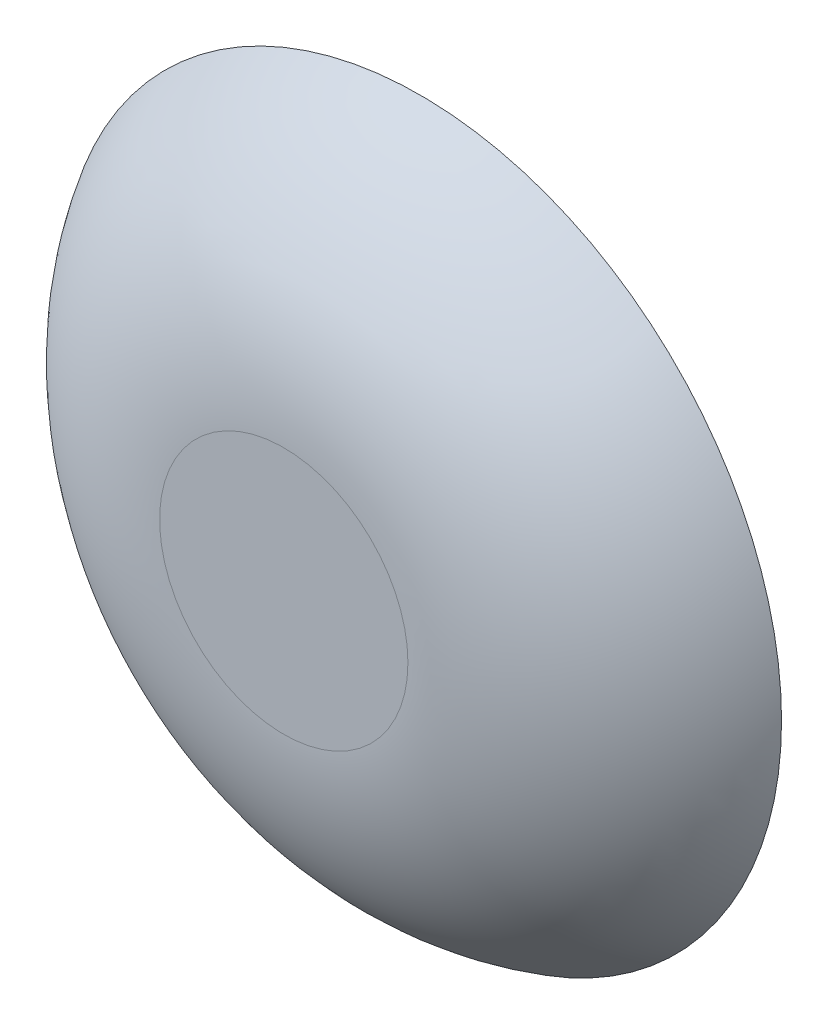
from build123d import *

# Parameters (mm, degrees)
SKETCH4_R           = 33
BOSS_EXTRUDE1_DEPTH = 12.5
FILLET1_R           = 25
SHELL3_T            = -2.54


with BuildPart() as part:
    # Sketch4 → Boss-Extrude1 (new body)
    with BuildSketch(Plane.XY):
        Circle(SKETCH4_R)
    extrude(amount=BOSS_EXTRUDE1_DEPTH)

    # Fillet1
    # the kernel refuses this fillet: 25 mm, written as the material it takes off along each edge
    with BuildSketch(Plane(origin=(0, 0, 12.5), x_dir=(1, 0, 0), z_dir=(0, -1, 0))) as fillet1_piece_1:
        with BuildLine():
            CenterArc((11.349364905, -25), FILLET1_R, 30, 60)
            Line((11.349364905, 0), (11.349364905, 0.5))
            Line((11.349364905, 0.5), (33, 0.5))
            Line((33, 0.5), (33.5, 0))
            ThreePointArc((33.5, 0), (33.5, -6.25), (33.433012702, -12.25))
            Line((33.433012702, -12.25), (33, -12.5))
        make_face()
    revolve(axis=Axis((0, 0, 12.5), (0, 0, 1)), mode=Mode.SUBTRACT)

    # Shell3
    shell3_openings = [part.faces().sort_by_distance(p)[0] for p in [
        (0, 0, 0),
    ]]
    offset(amount=SHELL3_T, openings=shell3_openings, kind=Kind.INTERSECTION)


solid = part.part
